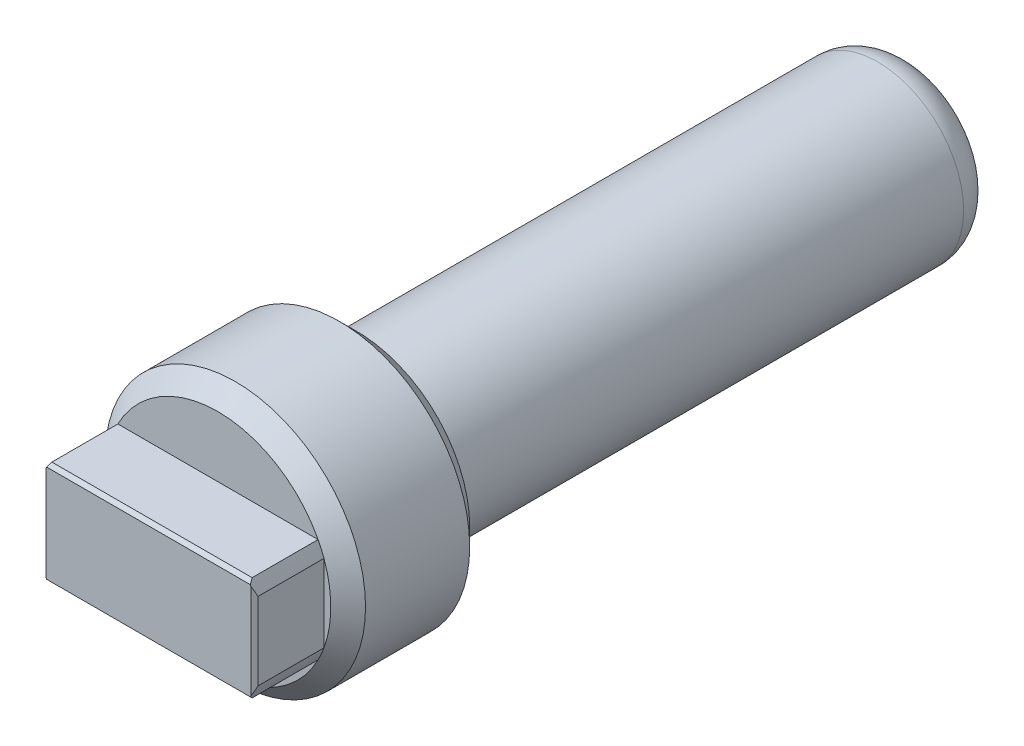
from build123d import *

# Parameters (mm, degrees)
SKETCH_1_R      = 2.475
EXTRUDE_1_DEPTH = 16
SKETCH_2_R      = 3.75
EXTRUDE_2_DEPTH = 4
CHAMFER_1_SIZE  = 0.5
EXTRUDE_3_DEPTH = 2
CHAMFER_2_SIZE  = 0.1
FILLET_1_R      = 1


with BuildPart() as part:
    # 스케치1 → 보스-돌출1 (new body)
    with BuildSketch(Plane.XY):
        Circle(SKETCH_1_R)
    extrude(amount=EXTRUDE_1_DEPTH)

    # 스케치2 → 보스-돌출2 (add)
    with BuildSketch(Plane.XY.offset(16)):
        Circle(SKETCH_2_R)
    extrude(amount=EXTRUDE_2_DEPTH)

    # 모따기1
    chamfer_1_edges = [part.edges().sort_by_distance(p)[0] for p in [
        (-3.75, 0, 16),
        (-3.75, 0, 20),
    ]]
    chamfer(chamfer_1_edges, length=CHAMFER_1_SIZE)

    # 스케치3 → 보스-돌출3 (add)
    with BuildSketch(Plane.XY.offset(20)):
        with BuildLine():
            ThreePointArc((-3.05263006, -1.115324937), (-2.974111162, -1.310405585), (-2.883140649, -1.5))
            Line((-2.883140649, -1.5), (2.883140649, -1.5))
            ThreePointArc((2.883140649, -1.5), (2.974111162, -1.310405585), (3.05263006, -1.115324937))
            Line((3.05263006, -1.115324937), (3.05263006, 1.115324937))
            ThreePointArc((3.05263006, 1.115324937), (2.974111162, 1.310405585), (2.883140649, 1.5))
            Line((2.883140649, 1.5), (-2.883140649, 1.5))
            ThreePointArc((-2.883140649, 1.5), (-2.974111162, 1.310405585), (-3.05263006, 1.115324937))
            Line((-3.05263006, 1.115324937), (-3.05263006, -1.115324937))
        make_face()
    extrude(amount=EXTRUDE_3_DEPTH)

    # 모따기2
    chamfer_2_edges = [part.edges().sort_by_distance(p)[0] for p in [
        (3.05263006, 0, 22),
        (-3.05263006, 0, 22),
        (0, -1.5, 22),
        (0, 1.5, 22),
    ]]
    chamfer(chamfer_2_edges, length=CHAMFER_2_SIZE)

    # 필렛1
    fillet_1_edges = [part.edges().sort_by_distance(p)[0] for p in [
        (-2.475, 0, 0),
    ]]
    fillet(fillet_1_edges, radius=FILLET_1_R)


solid = part.part
